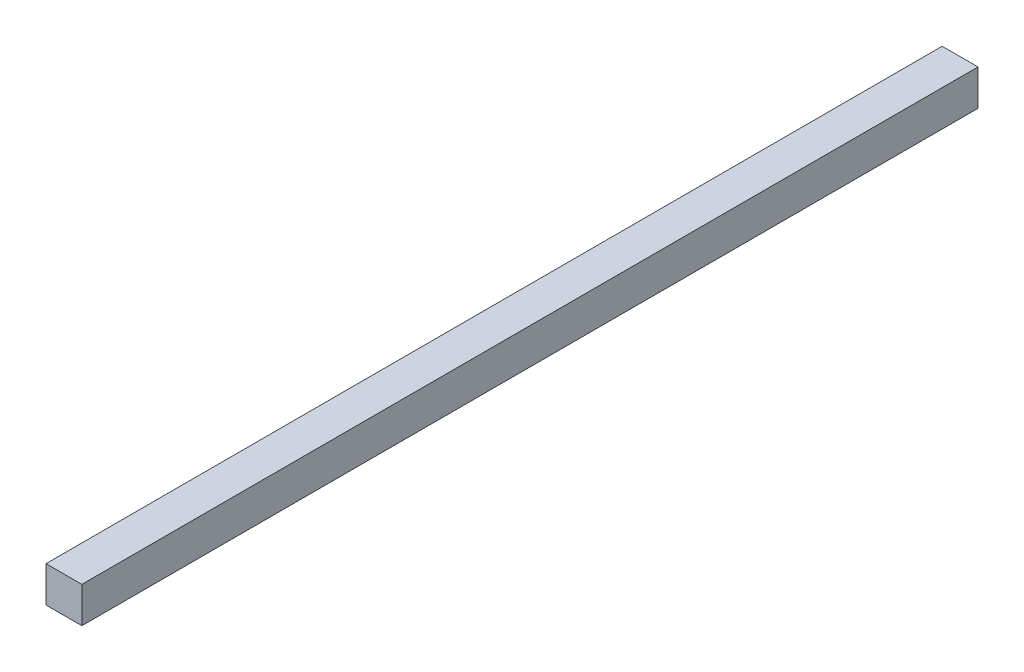
from build123d import *

# Parameters (mm, degrees)
SKETCH1_W           = 40
SKETCH1_H           = 40
BOSS_EXTRUDE1_DEPTH = 1000


with BuildPart() as part:
    # Sketch1 → Boss-Extrude1 (new body)
    with BuildSketch(Plane.XY):
        with Locations((-46.448171192, -6.018862214)):
            Rectangle(SKETCH1_W, SKETCH1_H)
    extrude(amount=BOSS_EXTRUDE1_DEPTH)


solid = part.part
